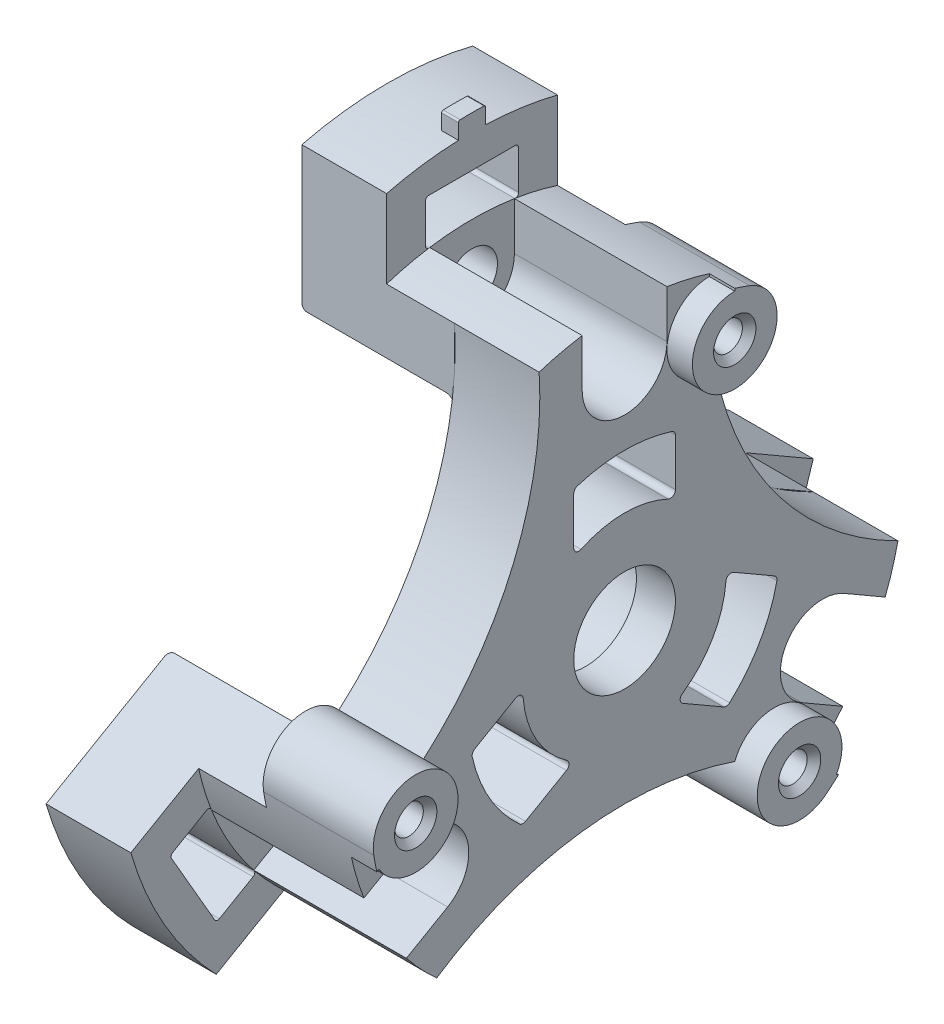
from build123d import *
from build123d.topology import SkipClean

# Parameters (mm, degrees)
SKETCH_2_R                           = 20
CUT_EXTRUDE_1_DEPTH                  = 10
PATTERN_CIRCULAR_1_COUNT             = 3
CUT_EXTRUDE_START                    = -10
CUT_EXTRUDE_2_DEPTH                  = 10
PATTERN_CIRCULAR_2_COUNT             = 3
SKETCH_4_R                           = 1.5
EXTRUDE_1_DEPTH                      = 9
PATTERN_CIRCULAR_3_COUNT             = 3
CUT_EXTRUDE_START_2                  = -1.7
CUT_EXTRUDE_3_DEPTH                  = 1.7
PATTERN_CIRCULAR_4_COUNT             = 3
CUT_EXTRUDE_4_DEPTH                  = 9
PATTERN_CIRCULAR_5_COUNT             = 3
EXTRUDE_START                        = -6.5
EXTRUDE_2_DEPTH                      = 6.5
SKETCH_9_R                           = 0.85
CUT_EXTRUDE_7_DEPTH                  = 6.4
CHAMFER_3_SIZE                       = 0.4
PATTERN_CIRCULAR_8_COUNT             = 3
CHAMFER_3_OF_PATTERN_CIRCULAR_8_SIZE = 0.4
CHAMFER_4_SIZE                       = 0.5
CHAMFER_4_SIZE2                      = 0.866025404
FILLET_6_R                           = 0.5
FILLET_7_R                           = 0.5
EXTRUDE_START_2                      = -5
EXTRUDE_3_DEPTH                      = 5
PATTERN_CIRCULAR_9_COUNT             = 3
EXTRUDE_4_DEPTH                      = 1
FILLET_9_R                           = 0.3
FILLET_10_R                          = 0.2
PATTERN_CIRCULAR_11_COUNT            = 4


with BuildPart() as part:
    # 草图1 → 旋转1 (revolve)
    with BuildSketch(Plane.XY, mode=Mode.PRIVATE) as revolve_1_sk:
        Polygon((-7, 6), (-5, 6), (-5, 16.5), (0, 16.5), (0, 3), (-2.3, 3), (-2.3, 3.975), (-7, 3.975), align=None)
    revolve(revolve_1_sk.sketch.rotate(Axis((-65.742857143, 0, 0), (1, 0, 0)), 90), axis=Axis((-65.742857143, 0, 0), (1, 0, 0)))

    # 草图2 → 切除-拉伸1 (cut)
    with BuildSketch(Plane.ZY.offset(5)):
        with Locations((-25, 14.43375673)):
            Circle(SKETCH_2_R)
    cut_extrude_1 = extrude(amount=-CUT_EXTRUDE_1_DEPTH, mode=Mode.SUBTRACT)

    # 阵列(圆周)1: 切除-拉伸1 ×3 about axis
    pattern_circular_1_axis = Axis((0, 0, 0), (1, 0, 0))
    for i in range(1, PATTERN_CIRCULAR_1_COUNT):
        add(cut_extrude_1.rotate(pattern_circular_1_axis, i * 360 / PATTERN_CIRCULAR_1_COUNT), mode=Mode.SUBTRACT)

    # 草图3 → 切除-拉伸2 (cut)
    with BuildSketch(Plane.ZY.offset(5).offset(CUT_EXTRUDE_START)):
        with BuildLine():
            Line((-3, 8.480566019), (-3, 5.692099788))
            ThreePointArc((-3, 5.692099788), (-2.860356745, 5.438553512), (-2.571428571, 5.421047417))
            ThreePointArc((-2.571428571, 5.421047417), (0, 6), (2.571428571, 5.421047417))
            ThreePointArc((2.571428571, 5.421047417), (2.860356745, 5.438553512), (3, 5.692099788))
            Line((3, 5.692099788), (3, 8.480566019))
            ThreePointArc((3, 8.480566019), (2.9421811, 8.657620571), (2.791011236, 8.766427795))
            ThreePointArc((2.791011236, 8.766427795), (0, 9.2), (-2.791011236, 8.766427795))
            ThreePointArc((-2.791011236, 8.766427795), (-2.9421811, 8.657620571), (-3, 8.480566019))
        make_face()
    cut_extrude_2 = extrude(amount=CUT_EXTRUDE_2_DEPTH, mode=Mode.SUBTRACT)

    # 阵列(圆周)2: 切除-拉伸2 ×3 about axis
    pattern_circular_2_axis = Axis((0, 0, 0), (1, 0, 0))
    for i in range(1, PATTERN_CIRCULAR_2_COUNT):
        add(cut_extrude_2.rotate(pattern_circular_2_axis, i * 360 / PATTERN_CIRCULAR_2_COUNT), mode=Mode.SUBTRACT)

    # 草图4 → 凸台-拉伸1 (add)
    with BuildSketch(Plane.ZY.offset(5)):
        with BuildLine():
            Line((-5.040834524, 15.711142139), (-5.040834524, 11.928641469))
            ThreePointArc((-5.040834524, 11.928641469), (-3.875431802, 12.356517647), (-2.674412578, 12.670833333))
            ThreePointArc((-2.674412578, 12.670833333), (0, 10.7), (2.674412578, 12.670833333))
            ThreePointArc((2.674412578, 12.670833333), (3.875431802, 12.356517647), (5.040834524, 11.928641469))
            Line((5.040834524, 11.928641469), (5.040834524, 15.711142139))
            ThreePointArc((5.040834524, 15.711142139), (0, 16.5), (-5.040834524, 15.711142139))
        make_face()
        with Locations((0, 13.5)):
            Circle(SKETCH_4_R, mode=Mode.SUBTRACT)
    extrude_1 = extrude(amount=EXTRUDE_1_DEPTH)

    # 阵列(圆周)3: 凸台-拉伸1 ×3 about axis
    pattern_circular_3_axis = Axis((0, 0, 0), (1, 0, 0))
    for i in range(1, PATTERN_CIRCULAR_3_COUNT):
        add(extrude_1.rotate(pattern_circular_3_axis, i * 360 / PATTERN_CIRCULAR_3_COUNT))

    # 草图5 → 切除-拉伸3 (cut)
    with BuildSketch(Plane.ZY.offset(14).offset(CUT_EXTRUDE_START_2)):
        with BuildLine():
            Line((-2.8, 12.643674308), (-2.8, 9.290818443))
            Line((-2.8, 9.290818443), (2.8, 9.290818443))
            Line((2.8, 9.290818443), (2.8, 12.643674308))
            ThreePointArc((2.8, 12.643674308), (0, 12.95), (-2.8, 12.643674308))
        make_face()
    cut_extrude_3 = extrude(amount=CUT_EXTRUDE_3_DEPTH, mode=Mode.SUBTRACT)

    # 阵列(圆周)4: 切除-拉伸3 ×3 about axis
    pattern_circular_4_axis = Axis((-65.742857143, 0, 0), (-1, 0, 0))
    for i in range(1, PATTERN_CIRCULAR_4_COUNT):
        add(cut_extrude_3.rotate(pattern_circular_4_axis, i * 360 / PATTERN_CIRCULAR_4_COUNT), mode=Mode.SUBTRACT)

    # 草图6 → 切除-拉伸4 (cut)
    with BuildSketch(Plane(origin=(0, 0, 0), x_dir=(0, 0, -1), z_dir=(1, 0, 0))):
        with BuildLine():
            Line((-2.5, 16.30950643), (-2.5, 13.5))
            ThreePointArc((-2.5, 13.5), (0, 11), (2.5, 13.5))
            Line((2.5, 13.5), (2.5, 16.30950643))
            ThreePointArc((2.5, 16.30950643), (0, 16.5), (-2.5, 16.30950643))
        make_face()
    cut_extrude_4 = extrude(amount=-CUT_EXTRUDE_4_DEPTH, mode=Mode.SUBTRACT)

    # 阵列(圆周)5: 切除-拉伸4 ×3 about axis
    pattern_circular_5_axis = Axis((0, 0, 0), (1, 0, 0))
    for i in range(1, PATTERN_CIRCULAR_5_COUNT):
        add(cut_extrude_4.rotate(pattern_circular_5_axis, i * 360 / PATTERN_CIRCULAR_5_COUNT), mode=Mode.SUBTRACT)

    # 草图7 → 凸台-拉伸2 (add)
    with BuildSketch(Plane.ZY.offset(5).offset(EXTRUDE_START)):
        with BuildLine():
            Line((-5, 15.576696831), (-5, 15.724185194))
            ThreePointArc((-5, 15.724185194), (-5.448667451, 15.574402814), (-5.892857143, 15.411821265))
            ThreePointArc((-5.892857143, 15.411821265), (-4.546023726, 10.618261242), (-5, 15.576696831))
        make_face()
    extrude_2 = extrude(amount=EXTRUDE_2_DEPTH)

    # 草图9 → 切除-拉伸7 (cut)
    with SkipClean():  # the faces are left unmerged after this step: merging them gives an invalid solid
        with BuildSketch(Plane(origin=(1.5, 0, 0), x_dir=(0, 0, -1), z_dir=(1, 0, 0))):
            with Locations((5, 13.076696831)):
                Circle(SKETCH_9_R)
        cut_extrude_7 = extrude(amount=-CUT_EXTRUDE_7_DEPTH, mode=Mode.SUBTRACT)

    # 倒角3
    chamfer_3_edges = [part.edges().sort_by_distance(p)[0] for p in [
        (1.5, 13.076696831, -4.15),
    ]]
    chamfer(chamfer_3_edges, length=CHAMFER_3_SIZE)

    # 阵列(圆周)8: 凸台-拉伸2, 切除-拉伸7 ×3 about axis
    with SkipClean():  # the faces are left unmerged after this step: merging them gives an invalid solid
        pattern_circular_8_axis = Axis((0, 0, 0), (1, 0, 0))
        add([extrude_2.rotate(pattern_circular_8_axis, i * 360 / PATTERN_CIRCULAR_8_COUNT) for i in range(1, PATTERN_CIRCULAR_8_COUNT)])
        add([cut_extrude_7.rotate(pattern_circular_8_axis, i * 360 / PATTERN_CIRCULAR_8_COUNT) for i in range(1, PATTERN_CIRCULAR_8_COUNT)], mode=Mode.SUBTRACT)

    # 倒角3 of 阵列(圆周)8
    chamfer_3_of_pattern_circular_8_edges = [part.edges().sort_by_distance(p)[0] for p in [
        (1.5, -2.94434299, 13.399751653),
        (1.5, -10.132353841, -9.249751653),
    ]]
    chamfer(chamfer_3_of_pattern_circular_8_edges, length=CHAMFER_3_OF_PATTERN_CIRCULAR_8_SIZE)

    # 倒角4
    chamfer_4_edges = [part.edges().sort_by_distance(p)[0] for p in [
        (-7, 0, -3.975),
    ]]
    chamfer_4_side = [part.faces().sort_by_distance(p)[0] for p in [
        (-7, 0, -4.144705627),
    ]]
    chamfer(chamfer_4_edges, length=CHAMFER_4_SIZE, length2=CHAMFER_4_SIZE2, reference=chamfer_4_side[0])

    # 圆角6
    # the kernel refuses this fillet: 0.5 mm, written as the material it adds along each edge
    with BuildSketch(Plane(origin=(-5, 0, 0), x_dir=(0, 0.8793281137807236, -0.47621640911967206), z_dir=(0, -0.47621640911967206, -0.8793281137807236))) as fillet_6_piece_1_section:
        with BuildLine():
            CenterArc((12.95 - FILLET_6_R, -FILLET_6_R), FILLET_6_R, 0, 90)
            Line((12.95, -FILLET_6_R), (12.95, 0))
            Line((12.95, 0), (12.95 - FILLET_6_R, 0))
        make_face()
    fillet_6_piece_1 = revolve(axis=Axis((-5, 0, 0), (1, 0, 0)), revolution_arc=22.050697628, mode=Mode.PRIVATE)
    fillet_6_piece_1 = split(fillet_6_piece_1, bisect_by=Plane(origin=(-5.112168205, 12.222030321, -5.040834524), z_dir=(0, 0, 1)), keep=Keep.TOP, mode=Mode.PRIVATE)
    fillet_6_piece_1 = fillet_6_piece_1 - Plane(origin=(-5.112168205, 13.5, 0), x_dir=(0, -0.2961309523809526, -0.9551473493874911), z_dir=(1, 0, 0)) * Cylinder(2.8, 52, mode=Mode.PRIVATE)
    add(fillet_6_piece_1)
    with BuildSketch(Plane(origin=(-5, 13.5, 0), x_dir=(0, 0.1457375577042098, 0.9893232860265708), z_dir=(0, 0.9893232860265708, -0.1457375577042098))) as fillet_6_piece_2:
        with BuildLine():
            CenterArc((2.8 + FILLET_6_R, -FILLET_6_R), FILLET_6_R, 90, 90)
            Line((2.8, -FILLET_6_R), (2.8, 0))
            Line((2.8, 0), (2.8 + FILLET_6_R, 0))
        make_face()
    revolve(axis=Axis((-5, 13.5, 0), (1, 0, 0)), revolution_arc=196.759983694)
    with BuildSketch(Plane(origin=(-5, 0, 0), x_dir=(0, 0.9937914719955359, 0.11125875331382269), z_dir=(0, 0.11125875331382269, -0.9937914719955359))) as fillet_6_piece_3_section:
        with BuildLine():
            CenterArc((12.95 - FILLET_6_R, -FILLET_6_R), FILLET_6_R, 0, 90)
            Line((12.95, -FILLET_6_R), (12.95, 0))
            Line((12.95, 0), (12.95 - FILLET_6_R, 0))
        make_face()
    fillet_6_piece_3 = revolve(axis=Axis((-5, 0, 0), (1, 0, 0)), revolution_arc=22.050697628, mode=Mode.PRIVATE)
    fillet_6_piece_3 = split(fillet_6_piece_3, bisect_by=Plane(origin=(-5.11216821, 12.222030475, 5.040834524), z_dir=(0, 0, -1)), keep=Keep.TOP, mode=Mode.PRIVATE)
    fillet_6_piece_3 = fillet_6_piece_3 - Plane(origin=(-5.11216821, 13.5, 0), x_dir=(0, -0.2961309523809526, -0.9551473493874911), z_dir=(1, 0, 0)) * Cylinder(2.8, 52, mode=Mode.PRIVATE)
    add(fillet_6_piece_3)
    with BuildSketch(Plane(origin=(-5, 0, 0), x_dir=(0, -0.8520795648870015, -0.5234122802361234), z_dir=(0, -0.5234122802361234, 0.8520795648870015))) as fillet_6_piece_4_section:
        with BuildLine():
            CenterArc((12.95 - FILLET_6_R, -FILLET_6_R), FILLET_6_R, 0, 90)
            Line((12.95, -FILLET_6_R), (12.95, 0))
            Line((12.95, 0), (12.95 - FILLET_6_R, 0))
        make_face()
    fillet_6_piece_4 = revolve(axis=Axis((-5, 0, 0), (1, 0, 0)), revolution_arc=22.050697628, mode=Mode.PRIVATE)
    fillet_6_piece_4 = split(fillet_6_piece_4, bisect_by=Plane(origin=(-5.112168205, -10.476505914, -8.064171482), z_dir=(0, 0.8660254037844384, -0.5000000000000004)), keep=Keep.TOP, mode=Mode.PRIVATE)
    fillet_6_piece_4 = fillet_6_piece_4 - Plane(origin=(-5.112168205, -6.75, -11.691342951), x_dir=(0, -0.6791163927364616, 0.7340306023025307), z_dir=(1, 0, 0)) * Cylinder(2.8, 52, mode=Mode.PRIVATE)
    add(fillet_6_piece_4)
    with BuildSketch(Plane(origin=(-5, -6.75, -11.691342951), x_dir=(0, 0.7839103194024034, -0.6208740702706321), z_dir=(0, -0.6208740702706321, -0.7839103194024034))) as fillet_6_piece_5:
        with BuildLine():
            CenterArc((2.8 + FILLET_6_R, -FILLET_6_R), FILLET_6_R, 90, 90)
            Line((2.8, -FILLET_6_R), (2.8, 0))
            Line((2.8, 0), (2.8 + FILLET_6_R, 0))
        make_face()
    revolve(axis=Axis((-5, -6.75, -11.691342951), (1, 0, 0)), revolution_arc=196.759983694)
    with BuildSketch(Plane(origin=(-5, 0, 0), x_dir=(0, -0.4005428292346119, -0.9162780374693769), z_dir=(0, -0.9162780374693769, 0.4005428292346119))) as fillet_6_piece_6_section:
        with BuildLine():
            CenterArc((12.95 - FILLET_6_R, -FILLET_6_R), FILLET_6_R, 0, 90)
            Line((12.95, -FILLET_6_R), (12.95, 0))
            Line((12.95, 0), (12.95 - FILLET_6_R, 0))
        make_face()
    fillet_6_piece_6 = revolve(axis=Axis((-5, 0, 0), (1, 0, 0)), revolution_arc=22.050697628, mode=Mode.PRIVATE)
    fillet_6_piece_6 = split(fillet_6_piece_6, bisect_by=Plane(origin=(-5.11216821, -1.745524484, -13.105006139), z_dir=(0, -0.8660254037844384, 0.5000000000000004)), keep=Keep.TOP, mode=Mode.PRIVATE)
    fillet_6_piece_6 = fillet_6_piece_6 - Plane(origin=(-5.11216821, -6.75, -11.691342951), x_dir=(0, -0.6791163927364616, 0.7340306023025307), z_dir=(1, 0, 0)) * Cylinder(2.8, 52, mode=Mode.PRIVATE)
    add(fillet_6_piece_6)
    with BuildSketch(Plane(origin=(-5, 0, 0), x_dir=(0, -0.027248548893721882, 0.999628689355796), z_dir=(0, 0.999628689355796, 0.027248548893721882))) as fillet_6_piece_7_section:
        with BuildLine():
            CenterArc((12.95 - FILLET_6_R, -FILLET_6_R), FILLET_6_R, 0, 90)
            Line((12.95, -FILLET_6_R), (12.95, 0))
            Line((12.95, 0), (12.95 - FILLET_6_R, 0))
        make_face()
    fillet_6_piece_7 = revolve(axis=Axis((-5, 0, 0), (1, 0, 0)), revolution_arc=22.050697628, mode=Mode.PRIVATE)
    fillet_6_piece_7 = split(fillet_6_piece_7, bisect_by=Plane(origin=(-5.112168205, -1.745524407, 13.105006005), z_dir=(0, -0.8660254037844388, -0.49999999999999983)), keep=Keep.TOP, mode=Mode.PRIVATE)
    fillet_6_piece_7 = fillet_6_piece_7 - Plane(origin=(-5.112168205, -6.75, 11.691342951), x_dir=(0, 0.9752473451174146, 0.22111674708496049), z_dir=(1, 0, 0)) * Cylinder(2.8, 52, mode=Mode.PRIVATE)
    add(fillet_6_piece_7)
    with BuildSketch(Plane(origin=(-5, -6.75, 11.691342951), x_dir=(0, -0.9296478771066136, -0.36844921575593936), z_dir=(0, -0.36844921575593936, 0.9296478771066136))) as fillet_6_piece_8:
        with BuildLine():
            CenterArc((2.8 + FILLET_6_R, -FILLET_6_R), FILLET_6_R, 90, 90)
            Line((2.8, -FILLET_6_R), (2.8, 0))
            Line((2.8, 0), (2.8 + FILLET_6_R, 0))
        make_face()
    revolve(axis=Axis((-5, -6.75, 11.691342951), (1, 0, 0)), revolution_arc=196.759983694)
    with BuildSketch(Plane(origin=(-5, 0, 0), x_dir=(0, -0.5932486427609238, 0.8050192841555547), z_dir=(0, 0.8050192841555547, 0.5932486427609238))) as fillet_6_piece_9_section:
        with BuildLine():
            CenterArc((12.95 - FILLET_6_R, -FILLET_6_R), FILLET_6_R, 0, 90)
            Line((12.95, -FILLET_6_R), (12.95, 0))
            Line((12.95, 0), (12.95 - FILLET_6_R, 0))
        make_face()
    fillet_6_piece_9 = revolve(axis=Axis((-5, 0, 0), (1, 0, 0)), revolution_arc=22.050697628, mode=Mode.PRIVATE)
    fillet_6_piece_9 = split(fillet_6_piece_9, bisect_by=Plane(origin=(-5.11216821, -10.476505991, 8.064171615), z_dir=(0, 0.8660254037844388, 0.49999999999999983)), keep=Keep.TOP, mode=Mode.PRIVATE)
    fillet_6_piece_9 = fillet_6_piece_9 - Plane(origin=(-5.11216821, -6.75, 11.691342951), x_dir=(0, 0.9752473451174146, 0.22111674708496049), z_dir=(1, 0, 0)) * Cylinder(2.8, 52, mode=Mode.PRIVATE)
    add(fillet_6_piece_9)

    # 圆角7
    fillet_7_edges = [part.edges().sort_by_distance(p)[0] for p in [
        (-7, 0, -6),
    ]]
    fillet(fillet_7_edges, radius=FILLET_7_R)

    # 草图11 → 凸台-拉伸3 (add)
    with BuildSketch(Plane.ZY.offset(14).offset(EXTRUDE_START_2)):
        with BuildLine():
            Line((-5.040834524, 15.711142139), (-5.040834524, 20.334514681))
            ThreePointArc((-5.040834524, 20.334514681), (-2.539135427, 20.795559413), (0, 20.95))
            ThreePointArc((0, 20.95), (2.539135427, 20.795559413), (5.040834524, 20.334514681))
            Line((5.040834524, 20.334514681), (5.040834524, 15.711142139))
            ThreePointArc((5.040834524, 15.711142139), (3.905398597, 16.031152853), (2.75, 16.269219404))
            Line((2.75, 16.269219404), (2.75, 18.8))
            ThreePointArc((2.75, 18.8), (2.691421356, 18.941421356), (2.55, 19))
            Line((2.55, 19), (-2.55, 19))
            ThreePointArc((-2.55, 19), (-2.691421356, 18.941421356), (-2.75, 18.8))
            Line((-2.75, 18.8), (-2.75, 16.269219404))
            ThreePointArc((-2.75, 16.269219404), (-3.905398597, 16.031152853), (-5.040834524, 15.711142139))
        make_face()
    extrude_3 = extrude(amount=EXTRUDE_3_DEPTH)

    # 阵列(圆周)9: 凸台-拉伸3 ×3 about axis
    pattern_circular_9_axis = Axis((0, 0, 0), (1, 0, 0))
    for i in range(1, PATTERN_CIRCULAR_9_COUNT):
        add(extrude_3.rotate(pattern_circular_9_axis, i * 360 / PATTERN_CIRCULAR_9_COUNT))

    # 草图12 → 凸台-拉伸4 (add)
    with BuildSketch(Plane(origin=(-9, 0, 0), x_dir=(0, 0, -1), z_dir=(1, 0, 0))):
        with BuildLine():
            Line((-0.8, 21.838784307), (-0.8, 20.934719965))
            ThreePointArc((-0.8, 20.934719965), (0, 20.95), (0.8, 20.934719965))
            Line((0.8, 20.934719965), (0.8, 21.838784307))
            ThreePointArc((0.8, 21.838784307), (0.771834414, 21.9083531), (0.703203661, 21.938732976))
            ThreePointArc((0.703203661, 21.938732976), (0, 21.95), (-0.703203661, 21.938732976))
            ThreePointArc((-0.703203661, 21.938732976), (-0.771834414, 21.9083531), (-0.8, 21.838784307))
        make_face()
    extrude(amount=-EXTRUDE_4_DEPTH)

    # 圆角9
    fillet_9_edges = [part.edges().sort_by_distance(p)[0] for p in [
        (-14, 12.538695277, -3.237841991),
        (-14, 12.538695277, 3.237841991),
        (-14, -9.073401056, -9.239907645),
        (-14, -3.465294221, -12.477749635),
        (-14, -3.465294221, 12.477749635),
        (-14, -9.073401056, 9.239907645),
    ]]
    fillet(fillet_9_edges, radius=FILLET_9_R)

    # 圆角10
    fillet_10_edges = [part.edges().sort_by_distance(p)[0] for p in [
        (-11.5, 16.269219404, -2.75),
        (-11.5, 16.269219404, 2.75),
        (-11.5, -10.516179562, -12.714557303),
        (-11.5, -5.753039841, -15.464557303),
        (-11.5, -5.753039841, 15.464557303),
        (-11.5, -10.516179562, 12.714557303),
    ]]
    fillet(fillet_10_edges, radius=FILLET_10_R)

    # 草图14 → 切除-旋转1 (revolve, cut)
    with BuildSketch(Plane.XY):
        Polygon((-7.421349426, 4.75), (-6.808974596, 4.75), (-6.133974596, 4.075), (-2.637734728, 4.075), (-2.637734728, 4), (-7.421349426, 4), align=None)
    cut_revolve_1 = revolve(axis=Axis((-11.20158177, 4, 0), (1, 0, 0)), mode=Mode.SUBTRACT)

    # 阵列(圆周)11: 切除-旋转1 ×4 about axis
    pattern_circular_11_axis = Axis((0, 0, 0), (1, 0, 0))
    for i in range(1, PATTERN_CIRCULAR_11_COUNT):
        add(cut_revolve_1.rotate(pattern_circular_11_axis, i * 360 / PATTERN_CIRCULAR_11_COUNT), mode=Mode.SUBTRACT)


solid = part.part
